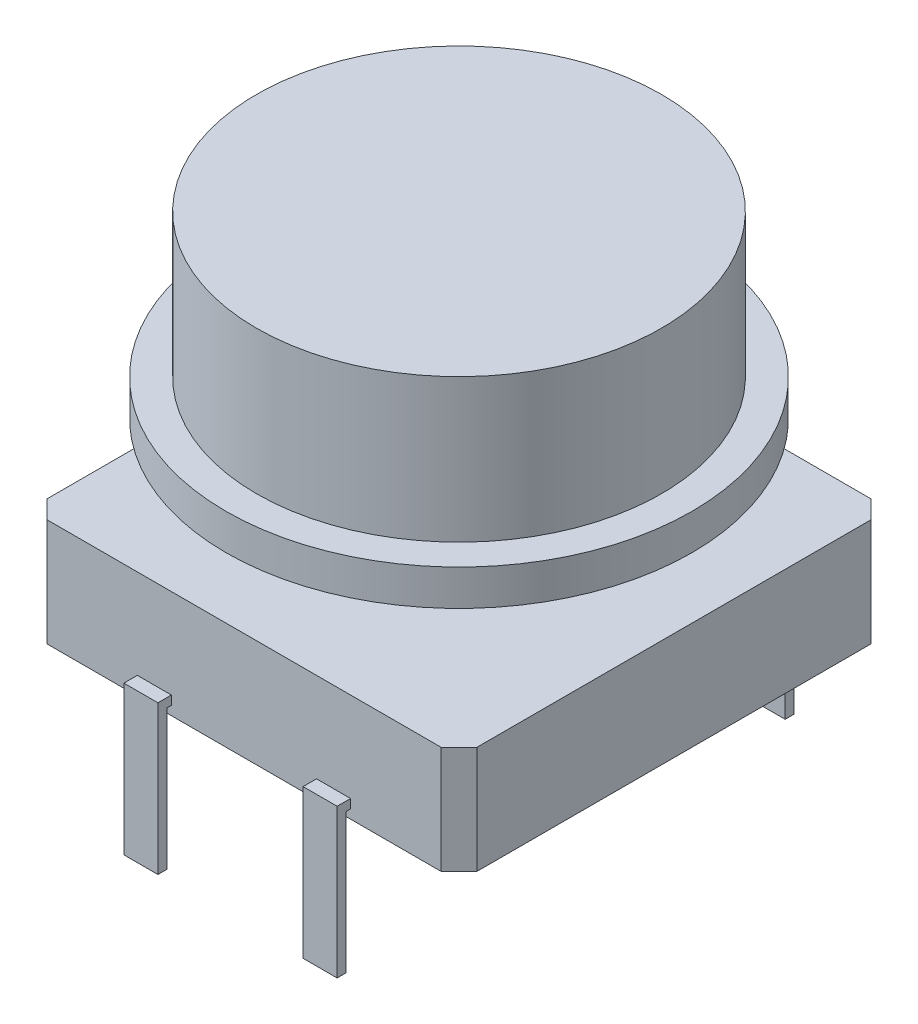
from build123d import *

# Parameters (mm, degrees)
BOSS_EXTRUDE1_DEPTH  = 3
SKETCH2_R            = 3.375
BOSS_EXTRUDE2_DEPTH  = 0.2
SKETCH3_W            = 3.5
SKETCH3_H            = 3.5
BOSS_EXTRUDE3_DEPTH  = 2
SKETCH4_R            = 6.5
BOSS_EXTRUDE4_DEPTH  = 1
SKETCH5_R            = 5.65
BOSS_EXTRUDE5_DEPTH  = 4
BOSS_EXTRUDE6_DEPTH  = 0.95
MIRROR2_COPY_1_DEPTH = 0.95


with BuildPart() as part:
    # Sketch1 → Boss-Extrude1 (new body)
    with BuildSketch(Plane(origin=(0, 0, 0), x_dir=(1, 0, 0), z_dir=(0, 1, 0))):
        Polygon((-5.5, 6), (-6, 5.5), (-6, -5.5), (-5.5, -6), (5.5, -6), (6, -5.5), (6, 5.5), (5.5, 6), align=None)
    extrude(amount=BOSS_EXTRUDE1_DEPTH)

    # Sketch2 → Boss-Extrude2 (add)
    with BuildSketch(Plane(origin=(0, 3, 0), x_dir=(1, 0, 0), z_dir=(0, 1, 0))):
        Circle(SKETCH2_R)
    extrude(amount=BOSS_EXTRUDE2_DEPTH)

    # Sketch3 → Boss-Extrude3 (add)
    with BuildSketch(Plane(origin=(0, 3.2, 0), x_dir=(1, 0, 0), z_dir=(0, 1, 0))):
        Rectangle(SKETCH3_W, SKETCH3_H)
    extrude(amount=BOSS_EXTRUDE3_DEPTH)

    # Sketch4 → Boss-Extrude4 (add)
    with BuildSketch(Plane(origin=(0, 5.2, 0), x_dir=(1, 0, 0), z_dir=(0, 1, 0))):
        Circle(SKETCH4_R)
    extrude(amount=BOSS_EXTRUDE4_DEPTH)

    # Sketch5 → Boss-Extrude5 (add)
    with BuildSketch(Plane(origin=(0, 6.2, 0), x_dir=(1, 0, 0), z_dir=(0, 1, 0))):
        Circle(SKETCH5_R)
    extrude(amount=BOSS_EXTRUDE5_DEPTH)

    # Sketch7 → Boss-Extrude6 (add)
    with BuildSketch(Plane.ZY.offset(2.975)):
        Polygon((6.375, 0.5), (6, 0.5), (6, 0.25), (6.125, 0.25), (6.125, -3.65), (6.375, -3.65), align=None)
    boss_extrude6 = extrude(amount=-BOSS_EXTRUDE6_DEPTH)

    # Mirror1: Boss-Extrude6 across plane
    add(boss_extrude6.mirror(Plane.ZY))

    # Mirror2: Boss-Extrude6 across plane
    add(boss_extrude6.mirror(Plane.XY))

    # Mirror2 copy 1 sketch → Mirror2 copy 1 (add)
    with BuildSketch(Plane(origin=(2.975, 0, 0), x_dir=(0, 0, -1), z_dir=(1, 0, 0))):
        Polygon((6.375, 0.5), (6, 0.5), (6, 0.25), (6.125, 0.25), (6.125, -3.65), (6.375, -3.65), align=None)
    extrude(amount=-MIRROR2_COPY_1_DEPTH)


solid = part.part
